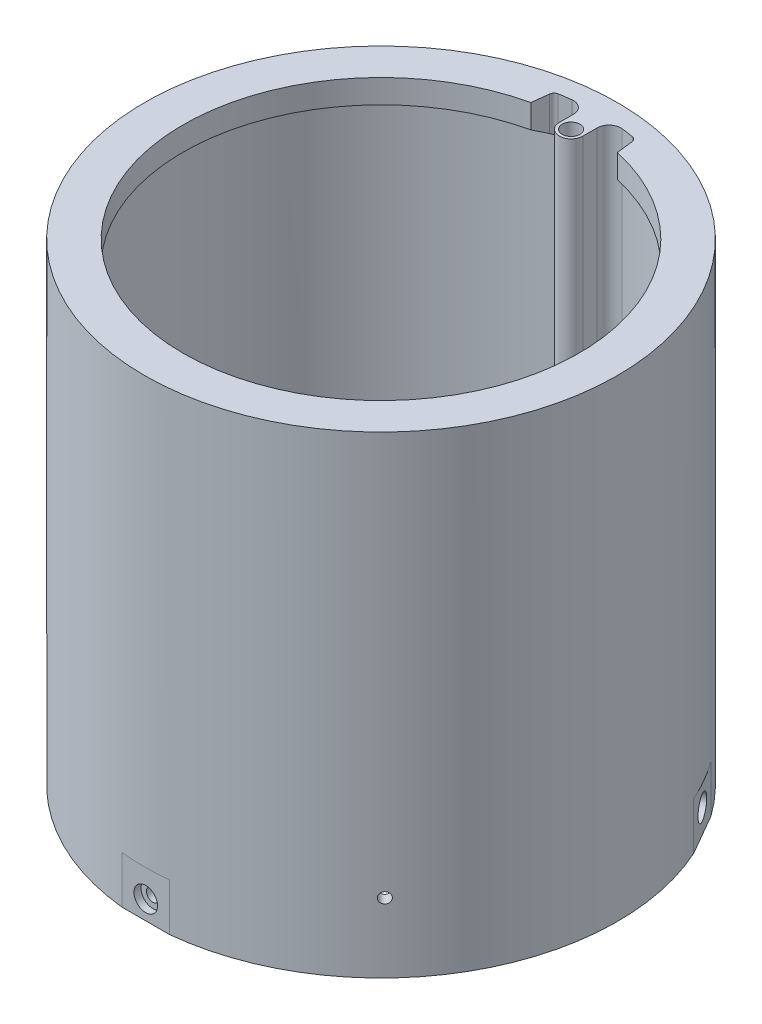
from build123d import *

# Parameters (mm, degrees)
SCHIZZO1_R                                           = 100
ESTRUSIONE_ESTRUSIONE1_DEPTH                         = 200
RACCORDO1_R                                          = 5
ESTRUSIONE_ESTRUSIONE2_START                         = -10
ESTRUSIONE_ESTRUSIONE2_DEPTH                         = 10
SMUSSO1_START                                        = 184.4999999
SMUSSO1_DEPTH                                        = 5.5000001
SMUSSO1_2_ANGLE                                      = 338.362808
RACCORDO2_R                                          = 2.113506
SCHIZZO6_R                                           = 3.75
TAGLIO_ESTRUSIONE1_DEPTH                             = 200
TAGLIO_ESTRUSIONE2_DEPTH                             = 20
FORO_LAMATO_PER_BULLONE_M5_A_TESTA_ESAGO_D           = 5.4
FORO_LAMATO_PER_BULLONE_M5_A_TESTA_ESAGO_DEPTH       = 30
FORO_LAMATO_PER_BULLONE_M5_A_TESTA_ESAGO_CBORE_D     = 10
FORO_LAMATO_PER_BULLONE_M5_A_TESTA_ESAGO_CBORE_DEPTH = 3
FORO_LAMATO_PER_BULLONE_M5_A_TESTA_ESAGO_TIP         = 1.622323671
FORO_LAMATO_PER_BULLONE_M5_A_TESTA_E_2_D             = 5.4
FORO_LAMATO_PER_BULLONE_M5_A_TESTA_E_2_DEPTH         = 30
FORO_LAMATO_PER_BULLONE_M5_A_TESTA_E_2_CBORE_D       = 10
FORO_LAMATO_PER_BULLONE_M5_A_TESTA_E_2_CBORE_DEPTH   = 3
FORO_LAMATO_PER_BULLONE_M5_A_TESTA_E_2_TIP           = 1.622323671
FORO_LAMATO_PER_BULLONE_M5_A_TESTA_E_3_D             = 5.4
FORO_LAMATO_PER_BULLONE_M5_A_TESTA_E_3_DEPTH         = 30
FORO_LAMATO_PER_BULLONE_M5_A_TESTA_E_3_CBORE_D       = 10
FORO_LAMATO_PER_BULLONE_M5_A_TESTA_E_3_CBORE_DEPTH   = 3
FORO_LAMATO_PER_BULLONE_M5_A_TESTA_E_3_TIP           = 1.622323671
FORO_LAMATO_PER_VITE_M4_A_TESTA_ESAGONAL_D           = 4.5
FORO_LAMATO_PER_VITE_M4_A_TESTA_ESAGONAL_DEPTH       = 30
FORO_LAMATO_PER_VITE_M4_A_TESTA_ESAGONAL_CBORE_D     = 10
FORO_LAMATO_PER_VITE_M4_A_TESTA_ESAGONAL_CBORE_DEPTH = 3
FORO_LAMATO_PER_VITE_M4_A_TESTA_ESAGONAL_TIP         = 1.351936393
FORO_LAMATO_PER_VITE_M4_A_TESTA_ESAG_2_D             = 4.5
FORO_LAMATO_PER_VITE_M4_A_TESTA_ESAG_2_DEPTH         = 30
FORO_LAMATO_PER_VITE_M4_A_TESTA_ESAG_2_CBORE_D       = 10
FORO_LAMATO_PER_VITE_M4_A_TESTA_ESAG_2_CBORE_DEPTH   = 3
FORO_LAMATO_PER_VITE_M4_A_TESTA_ESAG_2_TIP           = 1.351936393


with BuildPart() as part:
    # Schizzo1 → Estrusione-Estrusione1 (new body)
    with BuildSketch(Plane(origin=(0, 0, 0), x_dir=(1, 0, 0), z_dir=(0, 1, 0))):
        with Locations(Location((0, 0, 0), (0, 0, 270))):
            Circle(SCHIZZO1_R)
        with BuildLine():
            Line((-5, 80.409122957), (-5, 91.864029957))
            ThreePointArc((-5, 91.864029957), (0, -92), (5, 91.864029957))
            Line((5, 91.864029957), (5, 80.409122957))
            ThreePointArc((5, 80.409122957), (0, 75.409122957), (-5, 80.409122957))
        make_face(mode=Mode.SUBTRACT)
    extrude(amount=ESTRUSIONE_ESTRUSIONE1_DEPTH)

    # Raccordo1
    raccordo1_edges = [part.edges().sort_by_distance(p)[0] for p in [
        (-5, 100, -91.864029957),
        (5, 100, -91.864029957),
    ]]
    fillet(raccordo1_edges, radius=RACCORDO1_R)

    # Schizzo2 → Estrusione-Estrusione2 (add)
    with BuildSketch(Plane(origin=(0, 200, 0), x_dir=(1, 0, 0), z_dir=(0, 1, 0)).offset(ESTRUSIONE_ESTRUSIONE2_START)):
        with BuildLine():
            ThreePointArc((18.3, 81.674965565), (0, -83.7), (-18.3, 81.674965565))
            Line((-18.3, 81.674965565), (-17.268411156, 90.364827096))
            ThreePointArc((-17.268411156, 90.364827096), (-58.631502512, -70.89673415), (92, 0))
            ThreePointArc((92, 0), (70.89673415, 58.631502512), (17.268411156, 90.364827096))
            Line((17.268411156, 90.364827096), (18.3, 81.674965565))
        make_face()
    extrude(amount=ESTRUSIONE_ESTRUSIONE2_DEPTH)

    # Smusso1: read off the stored shape, not the designer's step
    # Smusso1 outline → Smusso1 (add)
    with BuildSketch(Plane(origin=(0, 0, 0), x_dir=(1, 0, 0), z_dir=(0, 1, 0)).offset(SMUSSO1_START)):
        with BuildLine():
            Line((17.268411156, 90.364827097), (18.3, 81.674965565))
            ThreePointArc((18.3, 81.674965565), (0, -83.7), (-18.3, 81.674965565))
            Line((-18.3, 81.674965565), (-17.268411156, 90.364827097))
            ThreePointArc((-17.268411156, 90.364827097), (0, -92), (17.268411156, 90.364827097))
        make_face()
    extrude(amount=SMUSSO1_DEPTH)

    # Smusso1 2 outline → Smusso1 2 (revolve, cut)
    with BuildSketch(Plane(origin=(0, 0, 0), x_dir=(-0.18770012126264535, 0, -0.9822263814813712), z_dir=(0.9822263814813712, 0, -0.18770012126264535))):
        Polygon((92, 184.5), (83.7, 189.98740256), (83.7, 184.4999999), align=None)
    revolve(axis=Axis((0, 0, 0), (0, 1, 0)), revolution_arc=SMUSSO1_2_ANGLE, mode=Mode.SUBTRACT)

    # Raccordo2
    raccordo2_edges = [part.edges().sort_by_distance(p)[0] for p in [
        (17.268411156, 195, -90.364827096),
        (-17.268411156, 195, -90.364827096),
    ]]
    fillet(raccordo2_edges, radius=RACCORDO2_R)

    # Schizzo6 → Taglio-Estrusione1 (cut)
    with BuildSketch(Plane.XZ):
        with Locations(Location((0, -80.409122957, 0), (0, 0, 270))):
            Circle(SCHIZZO6_R)
    extrude(amount=-TAGLIO_ESTRUSIONE1_DEPTH, mode=Mode.SUBTRACT)

    # Schizzo7 → Taglio-Estrusione2 (cut)
    with BuildSketch(Plane.XZ):
        with BuildLine():
            ThreePointArc((10, 99.498743711), (0, 100), (-10, 99.498743711))
            Line((-10, 99.498743711), (10, 99.498743711))
        make_face()
        with BuildLine():
            ThreePointArc((81.168439698, -58.409625893), (86.602540378, -50), (91.168439698, -41.089117817))
            Line((91.168439698, -41.089117817), (81.168439698, -58.409625893))
        make_face()
        with BuildLine():
            Line((-81.168439698, -58.409625893), (-91.168439698, -41.089117817))
            ThreePointArc((-91.168439698, -41.089117817), (-86.602540378, -50), (-81.168439698, -58.409625893))
        make_face()
    extrude(amount=-TAGLIO_ESTRUSIONE2_DEPTH, mode=Mode.SUBTRACT)

    # Foro lamato per Bullone M5 a testa esago
    with Locations(Plane(origin=(86.168439698, 0, -49.749371855), x_dir=(-0.4999999999999976, 0, -0.86602540378444), z_dir=(0.8660254037844402, 0, -0.4999999999999977))):
        with Locations((0, 10)):
            CounterBoreHole(FORO_LAMATO_PER_BULLONE_M5_A_TESTA_ESAGO_D / 2, FORO_LAMATO_PER_BULLONE_M5_A_TESTA_ESAGO_CBORE_D / 2, FORO_LAMATO_PER_BULLONE_M5_A_TESTA_ESAGO_CBORE_DEPTH, depth=FORO_LAMATO_PER_BULLONE_M5_A_TESTA_ESAGO_DEPTH)
            with Locations((0, 0, -(FORO_LAMATO_PER_BULLONE_M5_A_TESTA_ESAGO_DEPTH + FORO_LAMATO_PER_BULLONE_M5_A_TESTA_ESAGO_TIP / 2))):  # 118° drill point
                Cone(0, FORO_LAMATO_PER_BULLONE_M5_A_TESTA_ESAGO_D / 2, FORO_LAMATO_PER_BULLONE_M5_A_TESTA_ESAGO_TIP, mode=Mode.SUBTRACT)

    # Foro lamato per Bullone M5 a testa e 2
    with Locations(Plane(origin=(-86.168439698, 0, -49.749371855), x_dir=(-0.5000000000000044, 0, 0.8660254037844362), z_dir=(-0.8660254037844362, 0, -0.5000000000000044))):
        with Locations((0, 8)):
            CounterBoreHole(FORO_LAMATO_PER_BULLONE_M5_A_TESTA_E_2_D / 2, FORO_LAMATO_PER_BULLONE_M5_A_TESTA_E_2_CBORE_D / 2, FORO_LAMATO_PER_BULLONE_M5_A_TESTA_E_2_CBORE_DEPTH, depth=FORO_LAMATO_PER_BULLONE_M5_A_TESTA_E_2_DEPTH)
            with Locations((0, 0, -(FORO_LAMATO_PER_BULLONE_M5_A_TESTA_E_2_DEPTH + FORO_LAMATO_PER_BULLONE_M5_A_TESTA_E_2_TIP / 2))):  # 118° drill point
                Cone(0, FORO_LAMATO_PER_BULLONE_M5_A_TESTA_E_2_D / 2, FORO_LAMATO_PER_BULLONE_M5_A_TESTA_E_2_TIP, mode=Mode.SUBTRACT)

    # Foro lamato per Bullone M5 a testa e 3
    with Locations(Plane.XY.offset(99.498743711)):
        with Locations((0, 8)):
            CounterBoreHole(FORO_LAMATO_PER_BULLONE_M5_A_TESTA_E_3_D / 2, FORO_LAMATO_PER_BULLONE_M5_A_TESTA_E_3_CBORE_D / 2, FORO_LAMATO_PER_BULLONE_M5_A_TESTA_E_3_CBORE_DEPTH, depth=FORO_LAMATO_PER_BULLONE_M5_A_TESTA_E_3_DEPTH)
            with Locations((0, 0, -(FORO_LAMATO_PER_BULLONE_M5_A_TESTA_E_3_DEPTH + FORO_LAMATO_PER_BULLONE_M5_A_TESTA_E_3_TIP / 2))):  # 118° drill point
                Cone(0, FORO_LAMATO_PER_BULLONE_M5_A_TESTA_E_3_D / 2, FORO_LAMATO_PER_BULLONE_M5_A_TESTA_E_3_TIP, mode=Mode.SUBTRACT)

    # Foro lamato per Vite M4 a testa esagonale-1
    with Locations(Plane(origin=(65.801169357, 29.385293, 64.297792429), x_dir=(0.698889048141, 0, -0.715230101707), z_dir=(-0.715230101707, 0, -0.698889048141))):
        with Locations((0, 0)):
            CounterBoreHole(FORO_LAMATO_PER_VITE_M4_A_TESTA_ESAGONAL_D / 2, FORO_LAMATO_PER_VITE_M4_A_TESTA_ESAGONAL_CBORE_D / 2, FORO_LAMATO_PER_VITE_M4_A_TESTA_ESAGONAL_CBORE_DEPTH, depth=FORO_LAMATO_PER_VITE_M4_A_TESTA_ESAGONAL_DEPTH)
            with Locations((0, 0, -(FORO_LAMATO_PER_VITE_M4_A_TESTA_ESAGONAL_DEPTH + FORO_LAMATO_PER_VITE_M4_A_TESTA_ESAGONAL_TIP / 2))):  # 118° drill point
                Cone(0, FORO_LAMATO_PER_VITE_M4_A_TESTA_ESAGONAL_D / 2, FORO_LAMATO_PER_VITE_M4_A_TESTA_ESAGONAL_TIP, mode=Mode.SUBTRACT)

    # Foro lamato per Vite M4 a testa esag 2
    with Locations(Plane(origin=(-62.673817972, 46.161135949, -67.349777585), x_dir=(0.732062968471, 0, -0.68123697066), z_dir=(0.68123697066, 0, 0.732062968471))):
        with Locations((0, 0)):
            CounterBoreHole(FORO_LAMATO_PER_VITE_M4_A_TESTA_ESAG_2_D / 2, FORO_LAMATO_PER_VITE_M4_A_TESTA_ESAG_2_CBORE_D / 2, FORO_LAMATO_PER_VITE_M4_A_TESTA_ESAG_2_CBORE_DEPTH, depth=FORO_LAMATO_PER_VITE_M4_A_TESTA_ESAG_2_DEPTH)
            with Locations((0, 0, -(FORO_LAMATO_PER_VITE_M4_A_TESTA_ESAG_2_DEPTH + FORO_LAMATO_PER_VITE_M4_A_TESTA_ESAG_2_TIP / 2))):  # 118° drill point
                Cone(0, FORO_LAMATO_PER_VITE_M4_A_TESTA_ESAG_2_D / 2, FORO_LAMATO_PER_VITE_M4_A_TESTA_ESAG_2_TIP, mode=Mode.SUBTRACT)


solid = part.part
